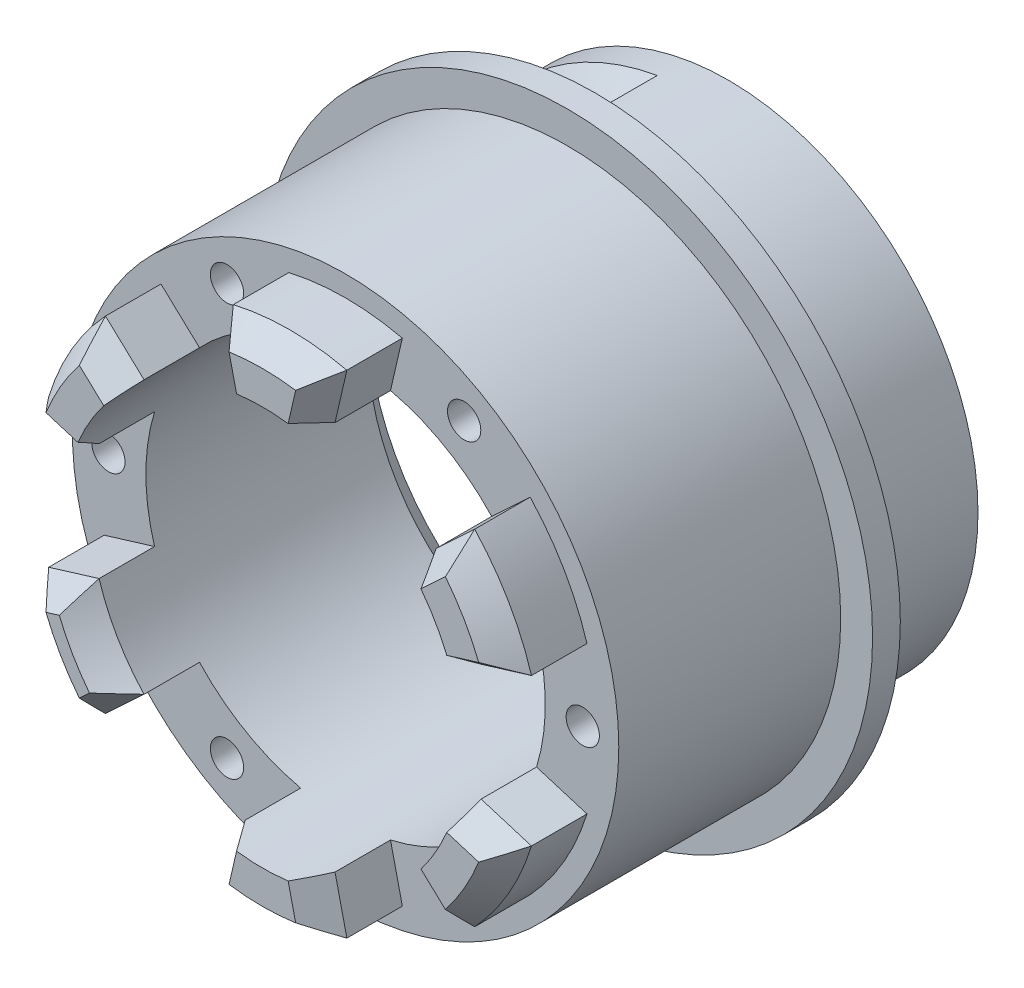
from build123d import *
from OCP.BRepFilletAPI import BRepFilletAPI_MakeChamfer
from build123d.topology import SkipClean

# Parameters (mm, degrees)
SKETCH_1_R          = 9
EXTRUDE_1_DEPTH     = 2
SKETCH_2_R          = 9
SKETCH_2_R_2        = 7.2
EXTRUDE_2_DEPTH     = 2.8
SKETCH_4_R          = 11
SKETCH_4_R_2        = 7.2
EXTRUDE_3_DEPTH     = 1
SKETCH_5_R          = 9.85
SKETCH_5_R_2        = 7.2
EXTRUDE_4_DEPTH     = 8
SKETCH_6_R          = 0.6
CUT_EXTRUDE_1_DEPTH = 8
SKETCH_7_R          = 3
SKETCH_7_R_2        = 1.1
CUT_EXTRUDE_2_DEPTH = 21.795191752
EXTRUDE_5_DEPTH     = 3
CHAMFER_1_SIZE      = 1
CHAMFER_1_SIZE2     = 0.700207538
CUT_EXTRUDE_START   = -2
SKETCH_11_R         = 1.1
CUT_EXTRUDE_3_DEPTH = 2.8
CHAMFER_2_SIZE      = 1


with BuildPart() as part:
    # 스케치1 → 보스-돌출1 (new body)
    with BuildSketch(Plane.XY):
        Circle(SKETCH_1_R)
    extrude(amount=EXTRUDE_1_DEPTH)

    # 스케치2 → 보스-돌출2 (add)
    with BuildSketch(Plane.XY.offset(2)):
        Circle(SKETCH_2_R)
        Circle(SKETCH_2_R_2, mode=Mode.SUBTRACT)
    extrude(amount=EXTRUDE_2_DEPTH)

    # 스케치4 → 보스-돌출3 (add)
    with BuildSketch(Plane.XY.offset(4.8)):
        Circle(SKETCH_4_R)
        Circle(SKETCH_4_R_2, mode=Mode.SUBTRACT)
    extrude(amount=EXTRUDE_3_DEPTH)

    # 스케치5 → 보스-돌출4 (add)
    with BuildSketch(Plane.XY.offset(5.8)):
        Circle(SKETCH_5_R)
        Circle(SKETCH_5_R_2, mode=Mode.SUBTRACT)
    extrude(amount=EXTRUDE_4_DEPTH)

    # 스케치6 → 컷-돌출1 (cut)
    with BuildSketch(Plane.XY.offset(13.8)):
        with Locations((8.55, 0)):
            Circle(SKETCH_6_R)
        with Locations((4.275, -7.404517202)):
            Circle(SKETCH_6_R)
        with Locations((-4.275, -7.404517202)):
            Circle(SKETCH_6_R)
        with Locations((-8.55, 0)):
            Circle(SKETCH_6_R)
        with Locations((-4.275, 7.404517202)):
            Circle(SKETCH_6_R)
        with Locations((4.275, 7.404517202)):
            Circle(SKETCH_6_R)
    extrude(amount=-CUT_EXTRUDE_1_DEPTH, mode=Mode.SUBTRACT)

    # 스케치7 → 컷-돌출2 (cut, through all)
    with BuildSketch(Plane(origin=(0, 0, 0), x_dir=(-1, 0, 0), z_dir=(0, 0, -1))):
        Circle(SKETCH_7_R)
        with Locations((-6, 0)):
            Circle(SKETCH_7_R_2)
        with Locations((6, 0)):
            Circle(SKETCH_7_R_2)
        with Locations((0, 6)):
            Circle(SKETCH_7_R_2)
        with Locations((0, -6)):
            Circle(SKETCH_7_R_2)
    extrude(amount=-CUT_EXTRUDE_2_DEPTH, mode=Mode.SUBTRACT)

    # 스케치10 → 보스-돌출5 (add)
    with SkipClean():  # the faces are left unmerged after this step: merging them gives an invalid solid
        with BuildSketch(Plane.XY.offset(13.8)):
            with BuildLine():
                Line((2.047054595, 8.86676759), (1.619647591, 7.015464466))
                ThreePointArc((1.619647591, 7.015464466), (0, 7.2), (-1.619647591, 7.015464466))
                Line((-1.619647591, 7.015464466), (-2.047054595, 8.86676759))
                ThreePointArc((-2.047054595, 8.86676759), (0, 9.1), (2.047054595, 8.86676759))
            make_face()
            with BuildLine():
                Line((6.655318685, 6.206185077), (5.265746652, 4.910388192))
                ThreePointArc((5.265746652, 4.910388192), (6.235382907, 3.6), (6.885394243, 2.105076274))
                Line((6.885394243, 2.105076274), (8.702373279, 2.660582513))
                ThreePointArc((8.702373279, 2.660582513), (7.880831174, 4.55), (6.655318685, 6.206185077))
            make_face()
            with BuildLine():
                Line((8.702373279, -2.660582513), (6.885394243, -2.105076274))
                ThreePointArc((6.885394243, -2.105076274), (6.235382907, -3.6), (5.265746652, -4.910388192))
                Line((5.265746652, -4.910388192), (6.655318685, -6.206185077))
                ThreePointArc((6.655318685, -6.206185077), (7.880831174, -4.55), (8.702373279, -2.660582513))
            make_face()
            with BuildLine():
                Line((2.047054595, -8.86676759), (1.619647591, -7.015464466))
                ThreePointArc((1.619647591, -7.015464466), (0, -7.2), (-1.619647591, -7.015464466))
                Line((-1.619647591, -7.015464466), (-2.047054595, -8.86676759))
                ThreePointArc((-2.047054595, -8.86676759), (0, -9.1), (2.047054595, -8.86676759))
            make_face()
            with BuildLine():
                Line((-6.655318685, -6.206185077), (-5.265746652, -4.910388192))
                ThreePointArc((-5.265746652, -4.910388192), (-6.235382907, -3.6), (-6.885394243, -2.105076274))
                Line((-6.885394243, -2.105076274), (-8.702373279, -2.660582513))
                ThreePointArc((-8.702373279, -2.660582513), (-7.880831174, -4.55), (-6.655318685, -6.206185077))
            make_face()
            with BuildLine():
                Line((-8.702373279, 2.660582513), (-6.885394243, 2.105076274))
                ThreePointArc((-6.885394243, 2.105076274), (-6.235382907, 3.6), (-5.265746652, 4.910388192))
                Line((-5.265746652, 4.910388192), (-6.655318685, 6.206185077))
                ThreePointArc((-6.655318685, 6.206185077), (-7.880831174, 4.55), (-8.702373279, 2.660582513))
            make_face()
        extrude(amount=EXTRUDE_5_DEPTH)

    # 모따기1: one chamfer whose edges measure the first distance from different faces: ONE call of the kernel's chamfer builder (chamfer() names one face for all edges)
    chamfer_1_edges_1 = [part.edges().sort_by_distance(p)[0] for p in [
        (-7.880831174, -4.55, 16.8),
    ]]
    chamfer_1_side_1 = [part.faces().sort_by_distance(p)[0] for p in [
        (-7.880831174, -4.55, 15.3),
    ]]
    chamfer_1_edges_2 = [part.edges().sort_by_distance(p)[0] for p in [
        (0, -9.1, 16.8),
    ]]
    chamfer_1_side_2 = [part.faces().sort_by_distance(p)[0] for p in [
        (0, -9.1, 15.3),
    ]]
    chamfer_1_edges_3 = [part.edges().sort_by_distance(p)[0] for p in [
        (7.880831174, -4.55, 16.8),
    ]]
    chamfer_1_side_3 = [part.faces().sort_by_distance(p)[0] for p in [
        (7.880831174, -4.55, 15.3),
    ]]
    chamfer_1_edges_4 = [part.edges().sort_by_distance(p)[0] for p in [
        (7.880831174, 4.55, 16.8),
    ]]
    chamfer_1_side_4 = [part.faces().sort_by_distance(p)[0] for p in [
        (7.880831174, 4.55, 15.3),
    ]]
    chamfer_1_edges_5 = [part.edges().sort_by_distance(p)[0] for p in [
        (0, 9.1, 16.8),
    ]]
    chamfer_1_side_5 = [part.faces().sort_by_distance(p)[0] for p in [
        (0, 9.1, 15.3),
    ]]
    chamfer_1_edges_6 = [part.edges().sort_by_distance(p)[0] for p in [
        (-7.880831174, 4.55, 16.8),
    ]]
    chamfer_1_side_6 = [part.faces().sort_by_distance(p)[0] for p in [
        (-7.880831174, 4.55, 15.3),
    ]]
    chamfer_1_edges_7 = [part.edges().sort_by_distance(p)[0] for p in [
        (-7.793883761, -2.382829393, 16.8),
    ]]
    chamfer_1_side_7 = [part.faces().sort_by_distance(p)[0] for p in [
        (-7.793883761, -2.382829393, 15.3),
    ]]
    chamfer_1_edges_8 = [part.edges().sort_by_distance(p)[0] for p in [
        (-6.235382907, -3.6, 16.8),
    ]]
    chamfer_1_side_8 = [part.faces().sort_by_distance(p)[0] for p in [
        (-6.235382907, -3.6, 15.3),
    ]]
    chamfer_1_edges_9 = [part.edges().sort_by_distance(p)[0] for p in [
        (-5.960532668, -5.558286635, 16.8),
    ]]
    chamfer_1_side_9 = [part.faces().sort_by_distance(p)[0] for p in [
        (-5.960532668, -5.558286635, 15.3),
    ]]
    chamfer_1_edges_10 = [part.edges().sort_by_distance(p)[0] for p in [
        (1.833351093, -7.941116028, 16.8),
    ]]
    chamfer_1_side_10 = [part.faces().sort_by_distance(p)[0] for p in [
        (1.833351093, -7.941116028, 15.3),
    ]]
    chamfer_1_edges_11 = [part.edges().sort_by_distance(p)[0] for p in [
        (-1.833351093, -7.941116028, 16.8),
    ]]
    chamfer_1_side_11 = [part.faces().sort_by_distance(p)[0] for p in [
        (-1.833351093, -7.941116028, 15.3),
    ]]
    chamfer_1_edges_12 = [part.edges().sort_by_distance(p)[0] for p in [
        (5.960532668, -5.558286635, 16.8),
    ]]
    chamfer_1_side_12 = [part.faces().sort_by_distance(p)[0] for p in [
        (5.960532668, -5.558286635, 15.3),
    ]]
    chamfer_1_edges_13 = [part.edges().sort_by_distance(p)[0] for p in [
        (7.793883761, -2.382829393, 16.8),
    ]]
    chamfer_1_side_13 = [part.faces().sort_by_distance(p)[0] for p in [
        (7.793883761, -2.382829393, 15.3),
    ]]
    chamfer_1_edges_14 = [part.edges().sort_by_distance(p)[0] for p in [
        (7.793883761, 2.382829393, 16.8),
    ]]
    chamfer_1_side_14 = [part.faces().sort_by_distance(p)[0] for p in [
        (7.793883761, 2.382829393, 15.3),
    ]]
    chamfer_1_edges_15 = [part.edges().sort_by_distance(p)[0] for p in [
        (5.960532668, 5.558286635, 16.8),
    ]]
    chamfer_1_side_15 = [part.faces().sort_by_distance(p)[0] for p in [
        (5.960532668, 5.558286635, 15.3),
    ]]
    chamfer_1_edges_16 = [part.edges().sort_by_distance(p)[0] for p in [
        (1.833351093, 7.941116028, 16.8),
    ]]
    chamfer_1_side_16 = [part.faces().sort_by_distance(p)[0] for p in [
        (1.833351093, 7.941116028, 15.3),
    ]]
    chamfer_1_edges_17 = [part.edges().sort_by_distance(p)[0] for p in [
        (-1.833351093, 7.941116028, 16.8),
    ]]
    chamfer_1_side_17 = [part.faces().sort_by_distance(p)[0] for p in [
        (-1.833351093, 7.941116028, 15.3),
    ]]
    chamfer_1_edges_18 = [part.edges().sort_by_distance(p)[0] for p in [
        (-7.793883761, 2.382829393, 16.8),
    ]]
    chamfer_1_side_18 = [part.faces().sort_by_distance(p)[0] for p in [
        (-7.793883761, 2.382829393, 15.3),
    ]]
    chamfer_1_edges_19 = [part.edges().sort_by_distance(p)[0] for p in [
        (-5.960532668, 5.558286635, 16.8),
    ]]
    chamfer_1_side_19 = [part.faces().sort_by_distance(p)[0] for p in [
        (-5.960532668, 5.558286635, 15.3),
    ]]
    chamfer_1 = BRepFilletAPI_MakeChamfer(part.part.solid().wrapped)
    for e in chamfer_1_edges_1:
        chamfer_1.Add(CHAMFER_1_SIZE, CHAMFER_1_SIZE2, e.wrapped, chamfer_1_side_1[0].wrapped)  # the first distance lies on this face
    for e in chamfer_1_edges_2:
        chamfer_1.Add(CHAMFER_1_SIZE, CHAMFER_1_SIZE2, e.wrapped, chamfer_1_side_2[0].wrapped)  # the first distance lies on this face
    for e in chamfer_1_edges_3:
        chamfer_1.Add(CHAMFER_1_SIZE, CHAMFER_1_SIZE2, e.wrapped, chamfer_1_side_3[0].wrapped)  # the first distance lies on this face
    for e in chamfer_1_edges_4:
        chamfer_1.Add(CHAMFER_1_SIZE, CHAMFER_1_SIZE2, e.wrapped, chamfer_1_side_4[0].wrapped)  # the first distance lies on this face
    for e in chamfer_1_edges_5:
        chamfer_1.Add(CHAMFER_1_SIZE, CHAMFER_1_SIZE2, e.wrapped, chamfer_1_side_5[0].wrapped)  # the first distance lies on this face
    for e in chamfer_1_edges_6:
        chamfer_1.Add(CHAMFER_1_SIZE, CHAMFER_1_SIZE2, e.wrapped, chamfer_1_side_6[0].wrapped)  # the first distance lies on this face
    for e in chamfer_1_edges_7:
        chamfer_1.Add(CHAMFER_1_SIZE, CHAMFER_1_SIZE2, e.wrapped, chamfer_1_side_7[0].wrapped)  # the first distance lies on this face
    for e in chamfer_1_edges_8:
        chamfer_1.Add(CHAMFER_1_SIZE, CHAMFER_1_SIZE2, e.wrapped, chamfer_1_side_8[0].wrapped)  # the first distance lies on this face
    for e in chamfer_1_edges_9:
        chamfer_1.Add(CHAMFER_1_SIZE, CHAMFER_1_SIZE2, e.wrapped, chamfer_1_side_9[0].wrapped)  # the first distance lies on this face
    for e in chamfer_1_edges_10:
        chamfer_1.Add(CHAMFER_1_SIZE, CHAMFER_1_SIZE2, e.wrapped, chamfer_1_side_10[0].wrapped)  # the first distance lies on this face
    for e in chamfer_1_edges_11:
        chamfer_1.Add(CHAMFER_1_SIZE, CHAMFER_1_SIZE2, e.wrapped, chamfer_1_side_11[0].wrapped)  # the first distance lies on this face
    for e in chamfer_1_edges_12:
        chamfer_1.Add(CHAMFER_1_SIZE, CHAMFER_1_SIZE2, e.wrapped, chamfer_1_side_12[0].wrapped)  # the first distance lies on this face
    for e in chamfer_1_edges_13:
        chamfer_1.Add(CHAMFER_1_SIZE, CHAMFER_1_SIZE2, e.wrapped, chamfer_1_side_13[0].wrapped)  # the first distance lies on this face
    for e in chamfer_1_edges_14:
        chamfer_1.Add(CHAMFER_1_SIZE, CHAMFER_1_SIZE2, e.wrapped, chamfer_1_side_14[0].wrapped)  # the first distance lies on this face
    for e in chamfer_1_edges_15:
        chamfer_1.Add(CHAMFER_1_SIZE, CHAMFER_1_SIZE2, e.wrapped, chamfer_1_side_15[0].wrapped)  # the first distance lies on this face
    for e in chamfer_1_edges_16:
        chamfer_1.Add(CHAMFER_1_SIZE, CHAMFER_1_SIZE2, e.wrapped, chamfer_1_side_16[0].wrapped)  # the first distance lies on this face
    for e in chamfer_1_edges_17:
        chamfer_1.Add(CHAMFER_1_SIZE, CHAMFER_1_SIZE2, e.wrapped, chamfer_1_side_17[0].wrapped)  # the first distance lies on this face
    for e in chamfer_1_edges_18:
        chamfer_1.Add(CHAMFER_1_SIZE, CHAMFER_1_SIZE2, e.wrapped, chamfer_1_side_18[0].wrapped)  # the first distance lies on this face
    for e in chamfer_1_edges_19:
        chamfer_1.Add(CHAMFER_1_SIZE, CHAMFER_1_SIZE2, e.wrapped, chamfer_1_side_19[0].wrapped)  # the first distance lies on this face
    add(Compound.cast(chamfer_1.Shape()), mode=Mode.REPLACE)

    # 스케치11 → 컷-돌출3 (cut)
    with BuildSketch(Plane(origin=(0, 0, 0), x_dir=(-1, 0, 0), z_dir=(0, 0, -1)).offset(CUT_EXTRUDE_START)):
        with BuildLine():
            Line((1.562833599, 8.863269777), (0.520944533, 2.954423259))
            ThreePointArc((0.520944533, 2.954423259), (3, 0), (0.520944533, -2.954423259))
            Line((0.520944533, -2.954423259), (1.562833599, -8.863269777))
            ThreePointArc((1.562833599, -8.863269777), (9, 0), (1.562833599, 8.863269777))
        make_face()
        with Locations((6, 0)):
            Circle(SKETCH_11_R, mode=Mode.SUBTRACT)
    extrude(amount=-CUT_EXTRUDE_3_DEPTH, mode=Mode.SUBTRACT)

    # 모따기2
    chamfer_2_edges = [part.edges().sort_by_distance(p)[0] for p in [
        (-7.2, 0, 4.8),
        (-9, 0, 2),
    ]]
    chamfer(chamfer_2_edges, length=CHAMFER_2_SIZE)


solid = part.part
